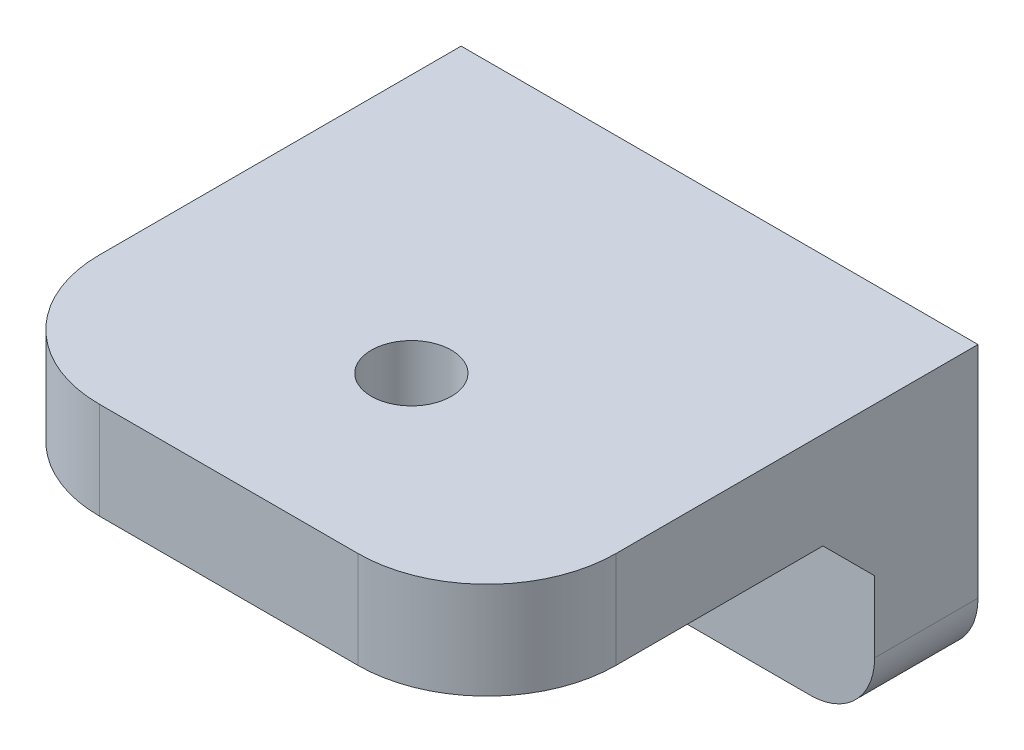
from build123d import *

# Parameters (mm, degrees)
SKETCH1_W           = 40
SKETCH1_H           = 22
BOSS_EXTRUDE1_DEPTH = 8
SKETCH2_W           = 40
SKETCH2_H           = 7.5
BOSS_EXTRUDE2_DEPTH = 30
CHAMFER1_SIZE       = 4
FILLET1_R           = 10
FILLET2_R           = 5
SKETCH3_R           = 3.1
CUT_EXTRUDE1_DEPTH  = 49.249352327


with BuildPart() as part:
    # Sketch1 → Boss-Extrude1 (new body)
    with BuildSketch(Plane.XY):
        with Locations((0, -15.406470283)):
            Rectangle(SKETCH1_W, SKETCH1_H)
    extrude(amount=BOSS_EXTRUDE1_DEPTH)

    # Sketch2 → Boss-Extrude2 (add)
    with BuildSketch(Plane.XY.offset(8)):
        with Locations((0, -8.156470283)):
            Rectangle(SKETCH2_W, SKETCH2_H)
    extrude(amount=BOSS_EXTRUDE2_DEPTH)

    # Chamfer1
    chamfer1_edges = [part.edges().sort_by_distance(p)[0] for p in [
        (0, -11.906470283, 8),
    ]]
    chamfer(chamfer1_edges, length=CHAMFER1_SIZE)

    # Fillet1
    fillet1_edges = [part.edges().sort_by_distance(p)[0] for p in [
        (20, -8.156470283, 38),
        (-20, -8.156470283, 38),
    ]]
    fillet(fillet1_edges, radius=FILLET1_R)

    # Fillet2
    fillet2_edges = [part.edges().sort_by_distance(p)[0] for p in [
        (20, -26.406470283, 4),
        (-20, -26.406470283, 4),
    ]]
    fillet(fillet2_edges, radius=FILLET2_R)

    # Sketch3 → Cut-Extrude1 (cut, through all)
    with BuildSketch(Plane(origin=(0, -4.406470283, 0), x_dir=(1, 0, 0), z_dir=(0, 1, 0))):
        with Locations((0, -23.851791769)):
            Circle(SKETCH3_R)
    extrude(amount=-CUT_EXTRUDE1_DEPTH, mode=Mode.SUBTRACT)


solid = part.part
